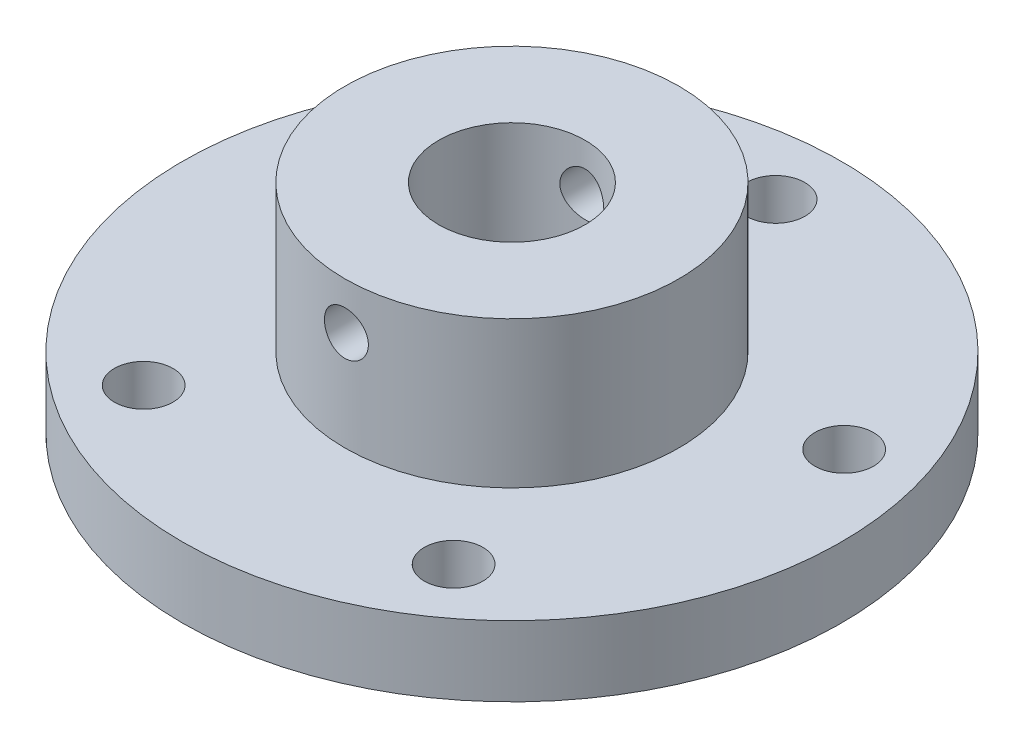
from build123d import *

# Parameters (mm, degrees)
F_1_2_0_5_DIAMETER_HOLE1_D = 12.7
CUT_EXTRUDE1_DEPTH         = 112.42124085
CUT_EXTRUDE1_DEPTH_BACK    = 112.42124085
SKETCH10_R                 = 4.7625


with BuildPart() as part:
    # Sketch1 → Revolve1 (revolve)
    with BuildSketch(Plane.XY):
        Polygon((15.875, 0), (71.4375, 0), (71.4375, 15.24), (36.195, 15.24), (36.195, 46.99), (15.875, 46.99), align=None)
    revolve(axis=Axis((0, 7.809475806, 0), (0, -1, 0)))

    # 1/2 (0.5) Diameter Hole1 (through all)
    with Locations(Plane(origin=(0, 15.24, 0), x_dir=(1, 0, 0), z_dir=(0, 1, 0))):
        with Locations((-54.352879906, 17.660321229), (0, 57.15), (54.352879906, 17.660321229), (33.591927169, -46.235321229), (-33.591927169, -46.235321229)):
            Hole(F_1_2_0_5_DIAMETER_HOLE1_D / 2)

    # Sketch10 → Cut-Extrude1 (cut, two sides: drawn at the far end of the back side and taken through both)
    with BuildSketch(Plane.XY.offset(-CUT_EXTRUDE1_DEPTH_BACK)):
        with Locations((0, 36.83)):
            Circle(SKETCH10_R)
    extrude(amount=CUT_EXTRUDE1_DEPTH + CUT_EXTRUDE1_DEPTH_BACK, mode=Mode.SUBTRACT)


solid = part.part
